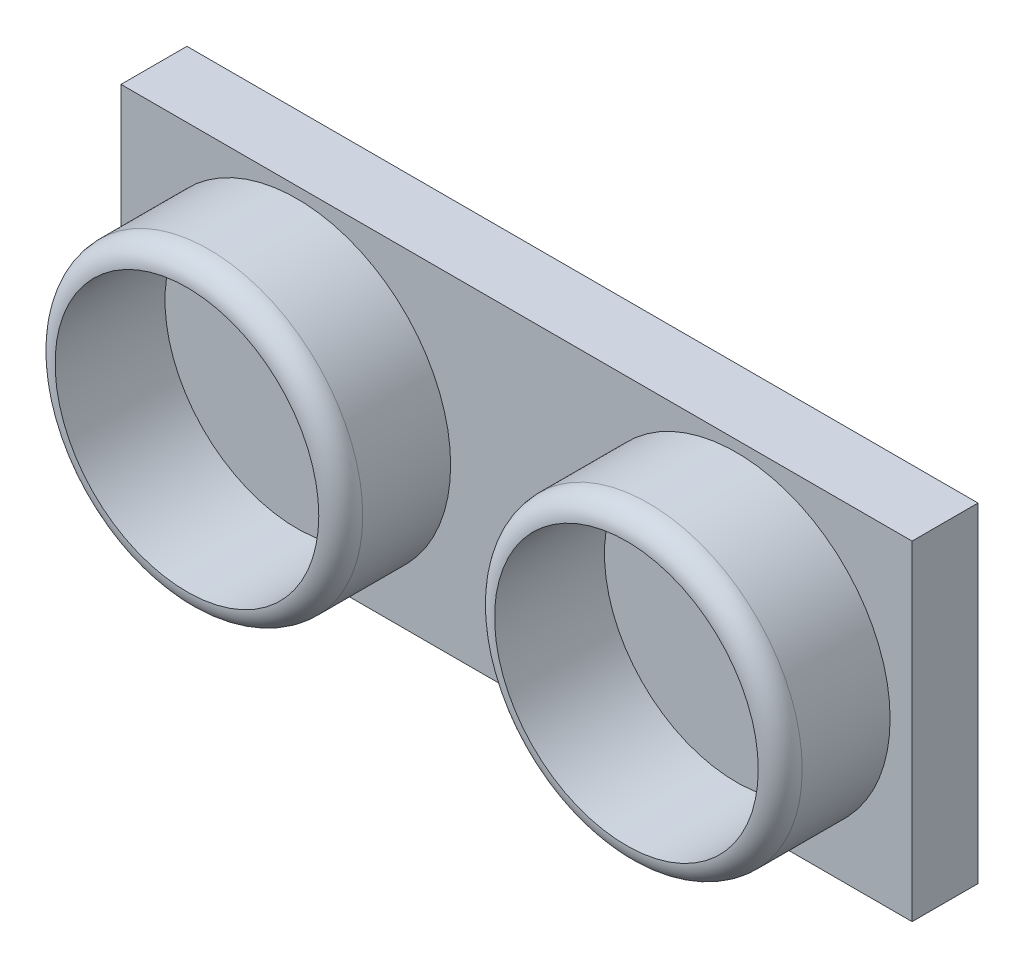
from build123d import *

# Parameters (mm, degrees)
SKETCH1_W           = 36
SKETCH1_H           = 15
BOSS_EXTRUDE1_DEPTH = 3
SKETCH2_R           = 7
SKETCH2_R_2         = 6
BOSS_EXTRUDE2_DEPTH = 5
FILLET1_R           = 1


with BuildPart() as part:
    # Sketch1 → Boss-Extrude1 (new body)
    with BuildSketch(Plane.XY):
        Rectangle(SKETCH1_W, SKETCH1_H)
    extrude(amount=BOSS_EXTRUDE1_DEPTH)

    # Sketch2 → Boss-Extrude2 (add)
    # profile 1 of 2: a face of its own
    with BuildSketch(Plane.XY.offset(3)):
        with Locations((-10, 0)):
            Circle(SKETCH2_R)
        with Locations((-10, 0)):
            Circle(SKETCH2_R_2, mode=Mode.SUBTRACT)
    # profile 2 of 2: a face of its own
    with BuildSketch(Plane.XY.offset(3)):
        with Locations((10, 0)):
            Circle(SKETCH2_R)
        with Locations((10, 0)):
            Circle(SKETCH2_R_2, mode=Mode.SUBTRACT)
    extrude(amount=BOSS_EXTRUDE2_DEPTH)

    # Fillet1
    fillet1_edges = [part.edges().sort_by_distance(p)[0] for p in [
        (-17, 0, 8),
        (3, 0, 8),
    ]]
    fillet(fillet1_edges, radius=FILLET1_R - 0.0001)  # a hair under: the kernel refuses the full size


solid = part.part
